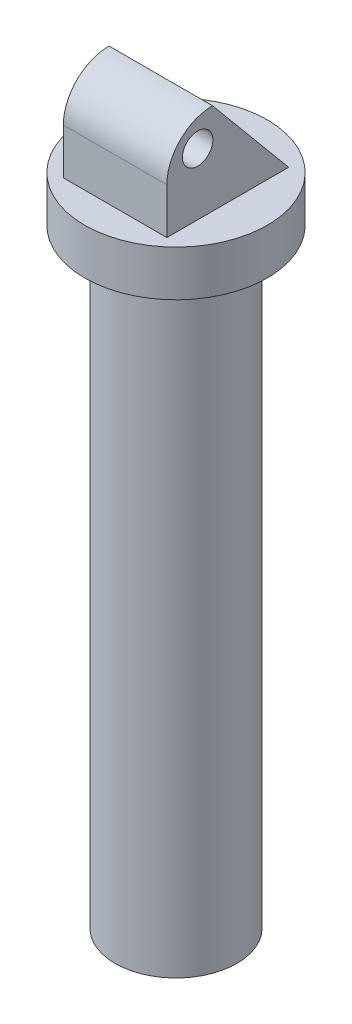
from build123d import *

# Parameters (mm, degrees)
SKETCH1_R           = 20
BOSS_EXTRUDE1_DEPTH = 200
SKETCH2_R           = 30
BOSS_EXTRUDE2_DEPTH = 15
SKETCH3_W           = 34
SKETCH3_H           = 40
BOSS_EXTRUDE3_DEPTH = 30
CUT_EXTRUDE1_DEPTH  = 59
FILLET1_R           = 15
SKETCH5_R           = 5
CUT_EXTRUDE2_DEPTH  = 59


with BuildPart() as part:
    # Sketch1 → Boss-Extrude1 (new body)
    with BuildSketch(Plane(origin=(0, 0, 0), x_dir=(1, 0, 0), z_dir=(0, 1, 0))):
        with Locations(Location((0, 0, 0), (0, 0, 270))):
            Circle(SKETCH1_R)
    extrude(amount=BOSS_EXTRUDE1_DEPTH)

    # Sketch2 → Boss-Extrude2 (add)
    with BuildSketch(Plane(origin=(0, 200, 0), x_dir=(1, 0, 0), z_dir=(0, 1, 0))):
        with Locations(Location((0, 0, 0), (0, 0, 270))):
            Circle(SKETCH2_R)
    extrude(amount=BOSS_EXTRUDE2_DEPTH)

    # Sketch3 → Boss-Extrude3 (add)
    with BuildSketch(Plane(origin=(0, 215, 0), x_dir=(1, 0, 0), z_dir=(0, 1, 0))):
        Rectangle(SKETCH3_W, SKETCH3_H)
    extrude(amount=BOSS_EXTRUDE3_DEPTH)

    # Sketch4 → Cut-Extrude1 (cut)
    with BuildSketch(Plane(origin=(17, 0, 0), x_dir=(0, 0, -1), z_dir=(1, 0, 0))):
        Polygon((20, 215), (-5, 245), (20, 245), align=None)
    extrude(amount=-CUT_EXTRUDE1_DEPTH, mode=Mode.SUBTRACT)

    # Fillet1
    fillet1_edges = [part.edges().sort_by_distance(p)[0] for p in [
        (0, 245, 20),
    ]]
    fillet(fillet1_edges, radius=FILLET1_R - 0.0001)  # a hair under: the kernel refuses the full size

    # Sketch5 → Cut-Extrude2 (cut)
    with BuildSketch(Plane(origin=(17, 0, 0), x_dir=(0, 0, -1), z_dir=(1, 0, 0))):
        with Locations((-9.891874818, 235.24975043)):
            Circle(SKETCH5_R)
    extrude(amount=-CUT_EXTRUDE2_DEPTH, mode=Mode.SUBTRACT)


solid = part.part
